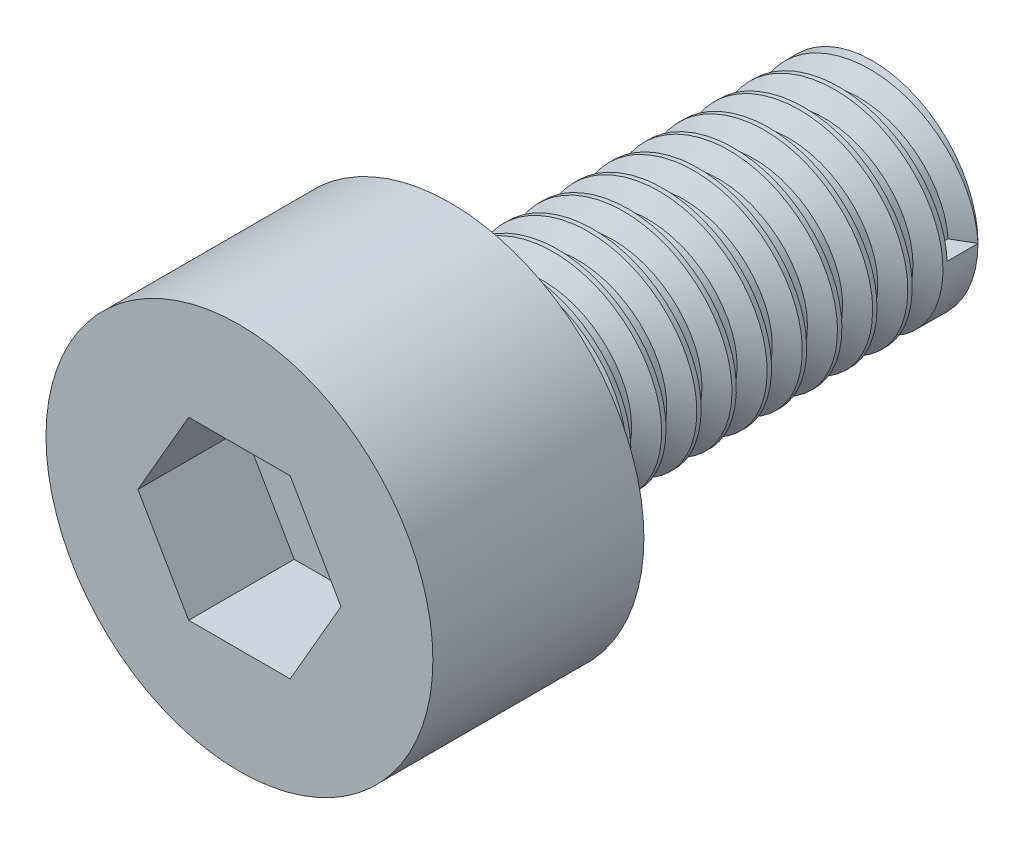
from build123d import *

# Parameters (mm, degrees)
SKETCH_1_R                = 1.5
EXTRUDE_3_10_DEPTH        = 6
M3X0_5_10_PITCH           = 0.5
SKETCH_2_R                = 2.75
EXTRUDE_5_5_3_DEPTH       = 3
CUT_EXTRUDE_2_5_1_5_DEPTH = 1.5


with BuildPart() as part:
    # Sketch 1 → 螺杆_直径3_长度10 (new body)
    with BuildSketch(Plane.XY):
        Circle(SKETCH_1_R)
    extrude(amount=EXTRUDE_3_10_DEPTH)

    # 真实螺纹_M3x0.5_右旋_长10: the profile of Sketch 1 2 profile screwed along a right-hand helix of 12 turns, 6 arcs to a turn; built about Z, then put on its axis
    m3x0_5_10_z = Axis((0, 0, 0), (0, 0, 1))
    m3x0_5_10_corners = [(1.5003, 0, -0.000173205), (1.5003, 0, 0.437673204), (1.229367063, 0, 0.281249999), (1.229367062, 0, 0.156249999)]
    with BuildLine(mode=Mode.PRIVATE) as m3x0_5_10_profile:
        Line(m3x0_5_10_corners[0], m3x0_5_10_corners[1])
        Line(m3x0_5_10_corners[1], m3x0_5_10_corners[2])
        Line(m3x0_5_10_corners[2], m3x0_5_10_corners[3])
        Line(m3x0_5_10_corners[3], m3x0_5_10_corners[0])
    m3x0_5_10_cap = Face(m3x0_5_10_profile.wire())
    m3x0_5_10_turn_angles = [0, 30, 60, 90, 120, 150, 180, 210, 240, 270, 300, 330, 360]
    m3x0_5_10_turn_weights = [1, 0.8660254037844387, 1, 0.8660254037844387, 1, 0.8660254037844387, 1, 0.8660254037844387, 1, 0.8660254037844387, 1, 0.8660254037844387, 1]
    m3x0_5_10_turn_rails = [Edge.make_bspline([Vector(p[0], p[1], 0).rotate(m3x0_5_10_z, m3x0_5_10_turn_angles[k]) / m3x0_5_10_turn_weights[k] + Vector(0, 0, p[2] + M3X0_5_10_PITCH * m3x0_5_10_turn_angles[k] / 360) for k in range(13)], [0, 0, 0, 1, 1, 2, 2, 3, 3, 4, 4, 5, 5, 6, 6, 6], 2, m3x0_5_10_turn_weights) for p in m3x0_5_10_corners]
    m3x0_5_10_turn_sides = [Face.make_surface_from_curves(m3x0_5_10_turn_rails[p[0]], m3x0_5_10_turn_rails[p[1]]) for p in [(0, 1), (1, 2), (2, 3), (3, 0)]]
    m3x0_5_10 = Plane(origin=(0, 0, 0), x_dir=(1, 0, 0), z_dir=(0, 0, 1)) * Solid(Shell([*[p.moved(Location((0, 0, M3X0_5_10_PITCH * i))) for i in range(12) for p in m3x0_5_10_turn_sides], m3x0_5_10_cap, m3x0_5_10_cap.rotate(m3x0_5_10_z, 4320).moved(Location((0, 0, M3X0_5_10_PITCH * 4320 / 360)))]))
    add(m3x0_5_10, mode=Mode.SUBTRACT)

    # 草图2 → 杯头_直径5.5_厚度3 (add)
    with BuildSketch(Plane.XY.offset(6)):
        Circle(SKETCH_2_R)
    extrude(amount=EXTRUDE_5_5_3_DEPTH)

    # 草图3 → 内六角_对边2.5_深1.5 (cut)
    with BuildSketch(Plane.XY.offset(9)):
        Polygon((1.443375673, 0), (0.721687836, 1.25), (-0.721687836, 1.25), (-1.443375673, 0), (-0.721687836, -1.25), (0.721687836, -1.25), align=None)
    extrude(amount=-CUT_EXTRUDE_2_5_1_5_DEPTH, mode=Mode.SUBTRACT)


solid = part.part
